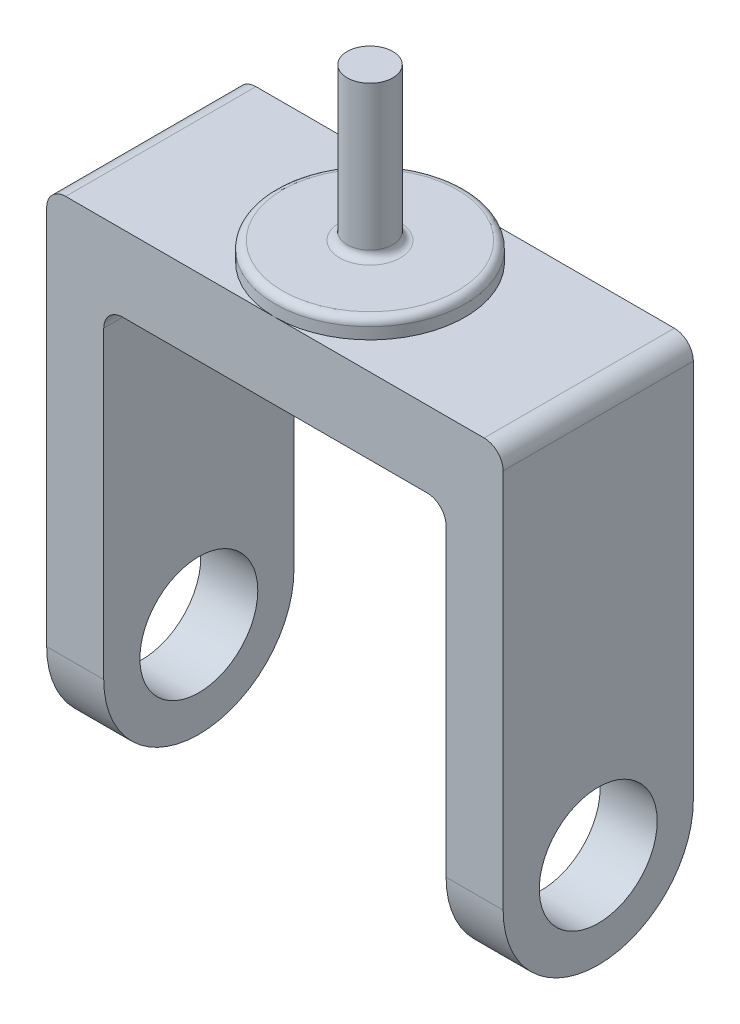
from build123d import *

# Parameters (mm, degrees)
BOSS_EXTRUDE1_DEPTH = 50
FILLET2_R           = 25
FILLET3_R           = 25
FILLET4_R           = 25
FILLET5_R           = 25
SKETCH2_R           = 15.5
CUT_EXTRUDE1_DEPTH  = 191.136542592
SKETCH3_R           = 25
BOSS_EXTRUDE2_DEPTH = 5
SKETCH4_R           = 6
BOSS_EXTRUDE3_DEPTH = 40
FILLET6_R           = 2
FILLET7_R           = 5


with BuildPart() as part:
    # Sketch1 → Boss-Extrude1 (new body)
    with BuildSketch(Plane.XY):
        Polygon((15, 8.751233612), (15, 118.751233612), (105, 118.751233612), (105, 8.751233612), (120, 8.751233612), (120, 138.751233612), (0, 138.751233612), (0, 8.751233612), align=None)
    extrude(amount=BOSS_EXTRUDE1_DEPTH)

    # Fillet2
    fillet2_edges = [part.edges().sort_by_distance(p)[0] for p in [
        (7.5, 8.751233612, 50),
    ]]
    fillet(fillet2_edges, radius=FILLET2_R)

    # Fillet3
    fillet3_edges = [part.edges().sort_by_distance(p)[0] for p in [
        (7.5, 8.751233612, 0),
    ]]
    fillet(fillet3_edges, radius=FILLET3_R - 0.0001)  # a hair under: the kernel refuses the full size

    # Fillet4
    fillet4_edges = [part.edges().sort_by_distance(p)[0] for p in [
        (112.5, 8.751233612, 50),
    ]]
    fillet(fillet4_edges, radius=FILLET4_R)

    # Fillet5
    fillet5_edges = [part.edges().sort_by_distance(p)[0] for p in [
        (112.5, 8.751233612, 0),
    ]]
    fillet(fillet5_edges, radius=FILLET5_R - 0.0001)  # a hair under: the kernel refuses the full size

    # Sketch2 → Cut-Extrude1 (cut, through all)
    with BuildSketch(Plane(origin=(120, 0, 0), x_dir=(0, 0, -1), z_dir=(1, 0, 0))):
        with Locations((-25, 33.751233612)):
            Circle(SKETCH2_R)
    extrude(amount=-CUT_EXTRUDE1_DEPTH, mode=Mode.SUBTRACT)

    # Sketch3 → Boss-Extrude2 (add)
    with BuildSketch(Plane(origin=(0, 138.751233612, 0), x_dir=(1, 0, 0), z_dir=(0, 1, 0))):
        with Locations(Location((60, -25, 0), (0, 0, 270))):
            Circle(SKETCH3_R)
    extrude(amount=BOSS_EXTRUDE2_DEPTH)

    # Sketch4 → Boss-Extrude3 (add)
    with BuildSketch(Plane(origin=(0, 143.751233612, 0), x_dir=(1, 0, 0), z_dir=(0, 1, 0))):
        with Locations(Location((60, -25, 0), (0, 0, 270))):
            Circle(SKETCH4_R)
    extrude(amount=BOSS_EXTRUDE3_DEPTH)

    # Fillet6
    fillet6_edges = [part.edges().sort_by_distance(p)[0] for p in [
        (60, 143.751233612, 0),
        (60, 143.751233612, 19),
    ]]
    fillet(fillet6_edges, radius=FILLET6_R)

    # Fillet7
    fillet7_edges = [part.edges().sort_by_distance(p)[0] for p in [
        (15, 118.751233612, 25),
        (0, 138.751233612, 25),
        (120, 138.751233612, 25),
        (105, 118.751233612, 25),
    ]]
    fillet(fillet7_edges, radius=FILLET7_R)


solid = part.part
